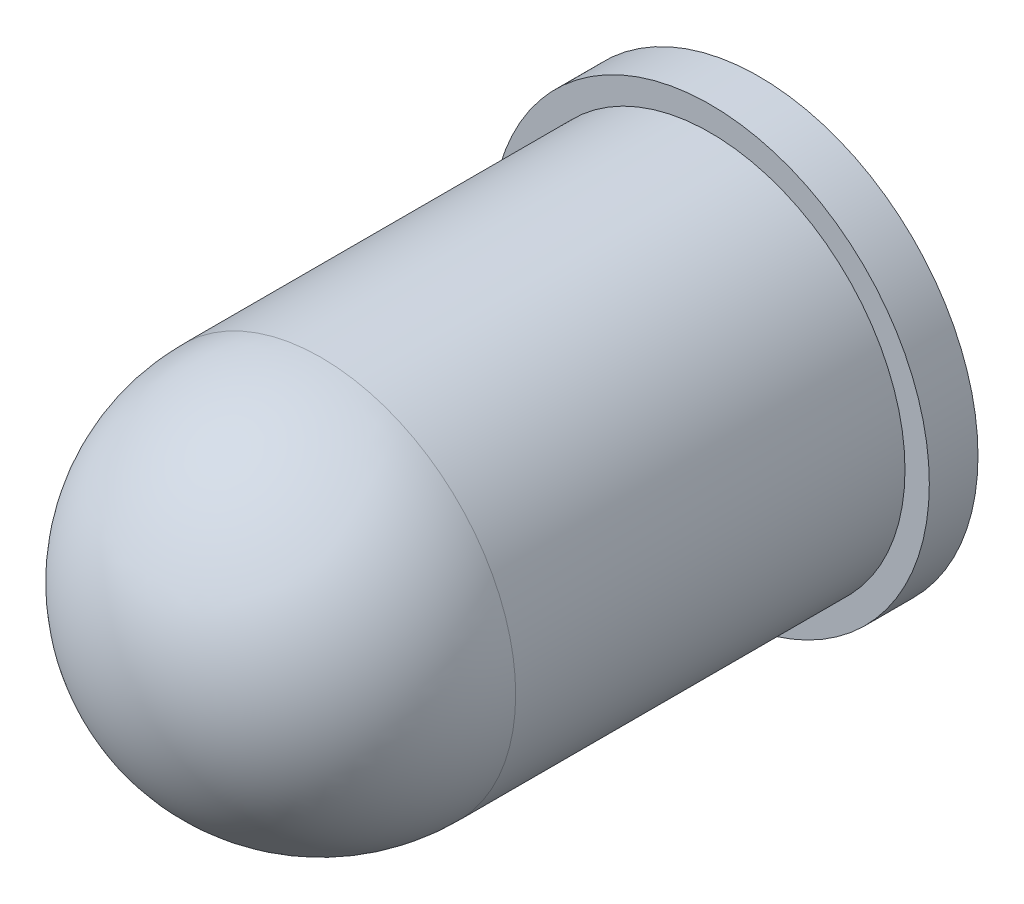
from build123d import *

# Parameters (mm, degrees)
SKETCH1_W = 4
SKETCH1_H = 8


# Read off the part's stored shape, not the designer's step: Shell1
with BuildPart() as part:
    # Sketch1 → Revolve1 (revolve)
    with BuildSketch(Plane.YZ, mode=Mode.PRIVATE) as revolve1_sk:
        with BuildLine():
            Line((0, 13), (0, 9))
            Line((0, 9), (4, 9))
            ThreePointArc((4, 9), (2.828427125, 11.828427125), (0, 13))
        make_face()
        with Locations((2, 5)):
            Rectangle(SKETCH1_W, SKETCH1_H)
        Polygon((4, 1), (0, 1), (0, 0), (4.5, 0), (4.5, 1), align=None)
    revolve(revolve1_sk.sketch.rotate(Axis((0, 0, 10.805456946), (0, 0, -1)), 90), axis=Axis((0, 0, 10.805456946), (0, 0, -1)))

    # Shell1 outline → Shell1 (revolve, cut)
    with BuildSketch(Plane.XZ):
        with BuildLine():
            Line((0, 0), (3, 0))
            Line((3, 0), (3, 8.999999997))
            ThreePointArc((3, 8.999999997), (2.121320345, 11.121320342), (0, 12))
            Line((0, 12), (0, 0))
        make_face()
    revolve(axis=Axis((0, 0, 0), (0, 0, 1)), mode=Mode.SUBTRACT)


solid = part.part
